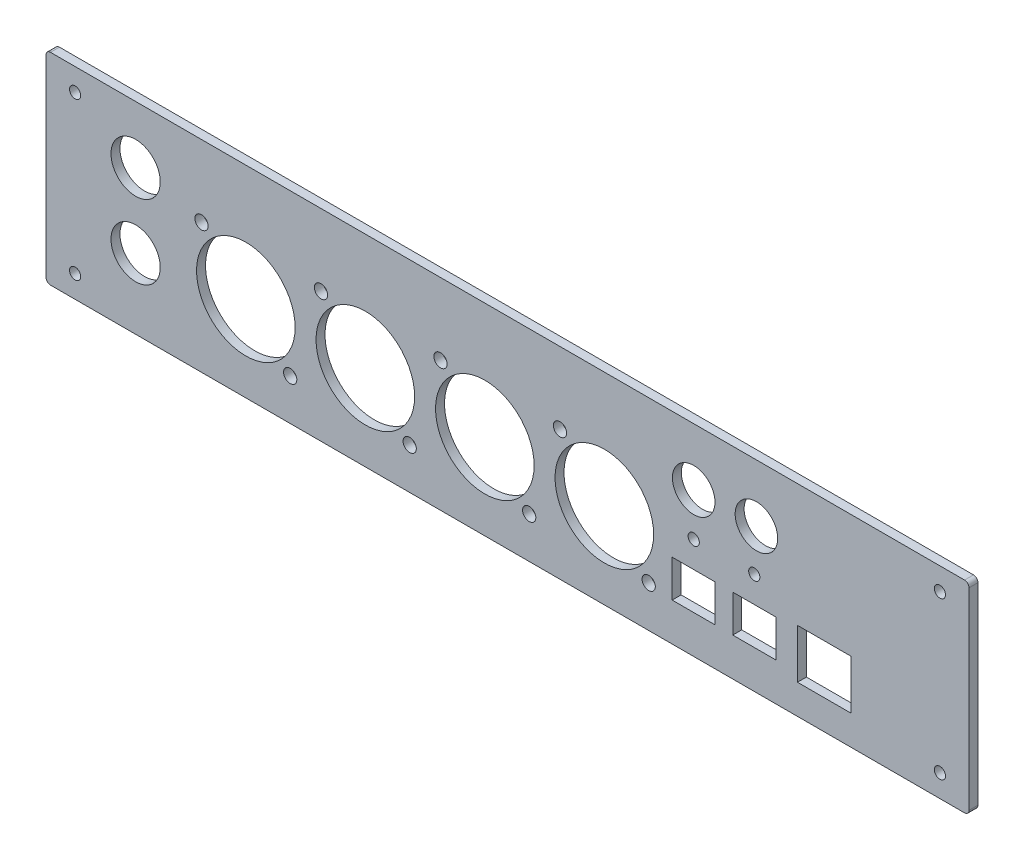
from build123d import *

# Parameters (mm, degrees)
SKETCH_5_W          = 206
SKETCH_5_H          = 45
EXTRUDE_3_DEPTH     = 2
SKETCH_6_W          = 9.6
SKETCH_6_H          = 8.3
SKETCH_6_R          = 11
SKETCH_6_R_2        = 1.474928536
SKETCH_6_R_3        = 1.25
SKETCH_6_R_4        = 4.75
SKETCH_6_R_5        = 5.5
CUT_EXTRUDE_1_DEPTH = 10
SKETCH_1_R          = 1.25
CUT_EXTRUDE_7_DEPTH = 70
FILLET_1_R          = 1


with BuildPart() as part:
    # 草图5 → 凸台-拉伸3 (new body)
    with BuildSketch(Plane.XY):
        with Locations((-3.884539257, 17.589033065)):
            Rectangle(SKETCH_5_W, SKETCH_5_H)
    extrude(amount=EXTRUDE_3_DEPTH)

    # 草图6 → 切除-拉伸1 (cut)
    with BuildSketch(Plane.XY.offset(2)):
        Polygon((60.825460743, 12.689033065), (60.825460743, 1.689033065), (72.825460743, 1.689033065), (72.825460743, 10.089033065), (72.825460743, 12.689033065), align=None)
        with Locations((37.665460743, 7.739033065)):
            Rectangle(SKETCH_6_W, SKETCH_6_H)
        with Locations((51.185460743, 7.739033065)):
            Rectangle(SKETCH_6_W, SKETCH_6_H)
        with Locations((-62.284539257, 14.189033065)):
            Circle(SKETCH_6_R)
        with Locations((-35.614539257, 14.189033065)):
            Circle(SKETCH_6_R)
        with Locations((-8.944539257, 14.189033065)):
            Circle(SKETCH_6_R)
        with Locations((17.725460743, 14.189033065)):
            Circle(SKETCH_6_R)
        with Locations((-72.184539257, 24.089033065)):
            Circle(SKETCH_6_R_2)
        with Locations((-52.384539257, 4.289033065)):
            Circle(SKETCH_6_R_2)
        with Locations((-45.514539257, 24.089033065)):
            Circle(SKETCH_6_R_2)
        with Locations((-25.714539257, 4.289033065)):
            Circle(SKETCH_6_R_2)
        with Locations((-18.844539257, 24.089033065)):
            Circle(SKETCH_6_R_2)
        with Locations((0.955460743, 4.289033065)):
            Circle(SKETCH_6_R_2)
        with Locations((7.825460743, 24.089033065)):
            Circle(SKETCH_6_R_2)
        with Locations((27.625460743, 4.289033065)):
            Circle(SKETCH_6_R_2)
        with Locations((37.665460743, 17.739033065)):
            Circle(SKETCH_6_R_3)
        with Locations((51.185460743, 17.739033065)):
            Circle(SKETCH_6_R_3)
        with Locations((51.665460743, 27.26693986)):
            Circle(SKETCH_6_R_4)
        with Locations((37.665460743, 27.26693986)):
            Circle(SKETCH_6_R_4)
        with Locations((-86.884539257, 27.26693986)):
            Circle(SKETCH_6_R_5)
        with Locations((-86.884539257, 10.74540099)):
            Circle(SKETCH_6_R_5)
    extrude(amount=-CUT_EXTRUDE_1_DEPTH, mode=Mode.SUBTRACT)

    # 草图1 → 切除-拉伸7 (cut)
    with BuildSketch(Plane.XY):
        with Locations((-100.384539257, 35.089033065)):
            Circle(SKETCH_1_R)
        with Locations((-100.384539257, 0.089033065)):
            Circle(SKETCH_1_R)
        with Locations((92.615460743, 0.089033065)):
            Circle(SKETCH_1_R)
        with Locations((92.615460743, 35.089033065)):
            Circle(SKETCH_1_R)
    extrude(amount=CUT_EXTRUDE_7_DEPTH, mode=Mode.SUBTRACT)

    # 圆角1
    fillet_1_edges = [part.edges().sort_by_distance(p)[0] for p in [
        (-106.884539257, -4.910966935, 1),
        (-106.884539257, 40.089033065, 1),
        (99.115460743, -4.910966935, 1),
        (99.115460743, 40.089033065, 1),
    ]]
    fillet(fillet_1_edges, radius=FILLET_1_R)


solid = part.part
